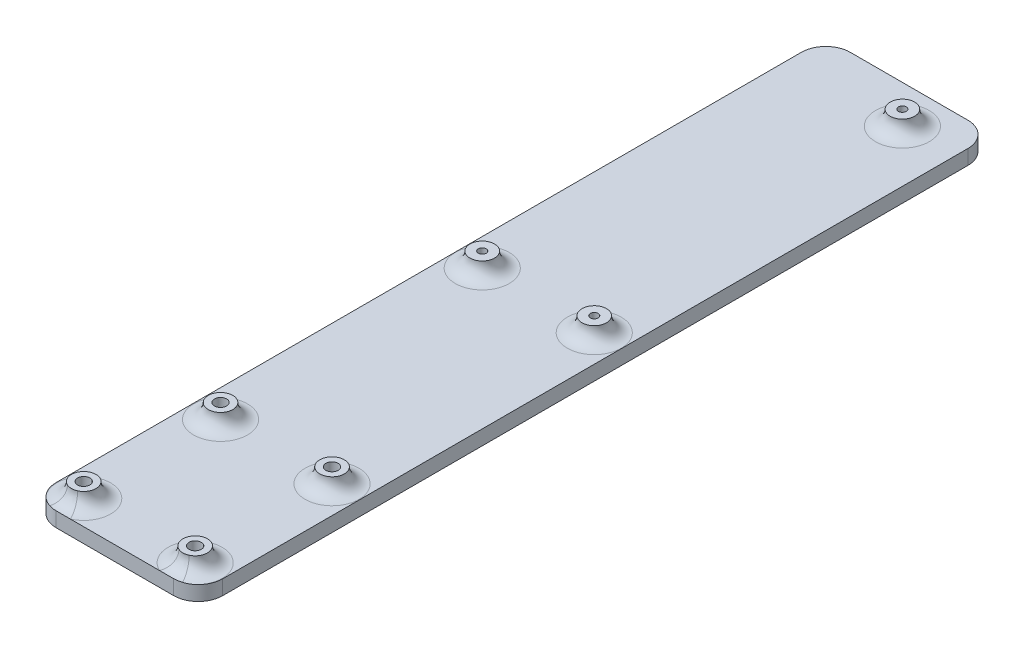
from build123d import *

# Parameters (mm, degrees)
SKETCH3_W                   = 34
SKETCH3_H                   = 162.08
BOSS_EXTRUDE1_DEPTH         = 3
SKETCH4_R                   = 2.5
BOSS_EXTRUDE2_DEPTH         = 3
FILLET1_R                   = 3
TAP_DRILL_FOR_M2X0_4_TAP1_D = 1.6
TAP_DRILL_FOR_M3X0_5_TAP1_D = 2.5
FILLET2_R                   = 5


# Some blends are built 0.0001 mm under size
with BuildPart() as part:
    # Sketch3 → Boss-Extrude1 (new body)
    with BuildSketch(Plane(origin=(0, 0, 0), x_dir=(1, 0, 0), z_dir=(0, 1, 0))):
        with Locations((0, -26.965)):
            Rectangle(SKETCH3_W, SKETCH3_H)
    extrude(amount=BOSS_EXTRUDE1_DEPTH)

    # Sketch4 → Boss-Extrude2 (add)
    with BuildSketch(Plane(origin=(0, 3, 0), x_dir=(1, 0, 0), z_dir=(0, 1, 0))):
        with Locations(Location((6.36, 46.345, 0), (0, 0, 270))):
            Circle(SKETCH4_R)
        with Locations(Location((-11.4346, -21.605, 0), (0, 0, 270))):
            Circle(SKETCH4_R)
        with Locations(Location((11.4254, -21.605, 0), (0, 0, 270))):
            Circle(SKETCH4_R)
        with Locations(Location((-11.375, -75.075, 0), (0, 0, 270))):
            Circle(SKETCH4_R)
        with Locations(Location((-11.375, -103.005, 0), (0, 0, 270))):
            Circle(SKETCH4_R)
        with Locations(Location((11.375, -103.005, 0), (0, 0, 270))):
            Circle(SKETCH4_R)
        with Locations(Location((11.375, -75.075, 0), (0, 0, 270))):
            Circle(SKETCH4_R)
    extrude(amount=BOSS_EXTRUDE2_DEPTH)

    # Fillet1
    fillet1_edges = [part.edges().sort_by_distance(p)[0] for p in [
        (6.36, 3, -48.845),
        (-11.4346, 3, 19.105),
        (11.4254, 3, 19.105),
        (-11.375, 3, 72.575),
        (-11.375, 3, 100.505),
        (11.375, 3, 100.505),
        (11.375, 3, 72.575),
    ]]
    fillet(fillet1_edges, radius=FILLET1_R - 0.0001)  # a hair under: the kernel refuses the full size

    # Tap Drill for M2x0.4 Tap1 (through all)
    with Locations(Plane(origin=(0, 6, 0), x_dir=(1, 0, 0), z_dir=(0, 1, 0))):
        with Locations((6.36, 46.345), (-11.4346, -21.605), (11.4254, -21.605)):
            Hole(TAP_DRILL_FOR_M2X0_4_TAP1_D / 2)

    # Tap Drill for M3x0.5 Tap1 (through all)
    with Locations(Plane(origin=(0, 6, 0), x_dir=(1, 0, 0), z_dir=(0, 1, 0))):
        with Locations((-11.375, -75.075), (-11.375, -103.005), (11.375, -103.005), (11.375, -75.075)):
            Hole(TAP_DRILL_FOR_M3X0_5_TAP1_D / 2)

    # Fillet2
    # the kernel refuses this fillet: 5 mm, written as the material it takes off along each edge
    with BuildSketch(Plane(origin=(-17, -12.5, -54.075), x_dir=(1, 0, 0), z_dir=(0, 1, 0)), Plane(origin=(17, -12.5, -54.075), x_dir=(0, 0, 1), z_dir=(0, 1, 0)), Plane(origin=(17, -12.5, 108.005), x_dir=(-1, 0, 0), z_dir=(0, 1, 0))) as fillet2_piece_1:
        with BuildLine():
            CenterArc((FILLET2_R, -FILLET2_R), FILLET2_R, 90, 90)
            Line((0, -FILLET2_R), (0, 0))
            Line((0, 0), (FILLET2_R, 0))
        make_face()
    extrude(amount=28, mode=Mode.SUBTRACT)
    with BuildSketch(Plane(origin=(-17, -12.5, 108.005), x_dir=(1, 0, 0), z_dir=(0, 1, 0))) as fillet2_piece_2:
        with BuildLine():
            CenterArc((FILLET2_R, FILLET2_R), FILLET2_R, 180, 90)
            Line((0, FILLET2_R), (0, 0))
            Line((0, 0), (FILLET2_R, 0))
        make_face()
    extrude(amount=28, mode=Mode.SUBTRACT)


solid = part.part
